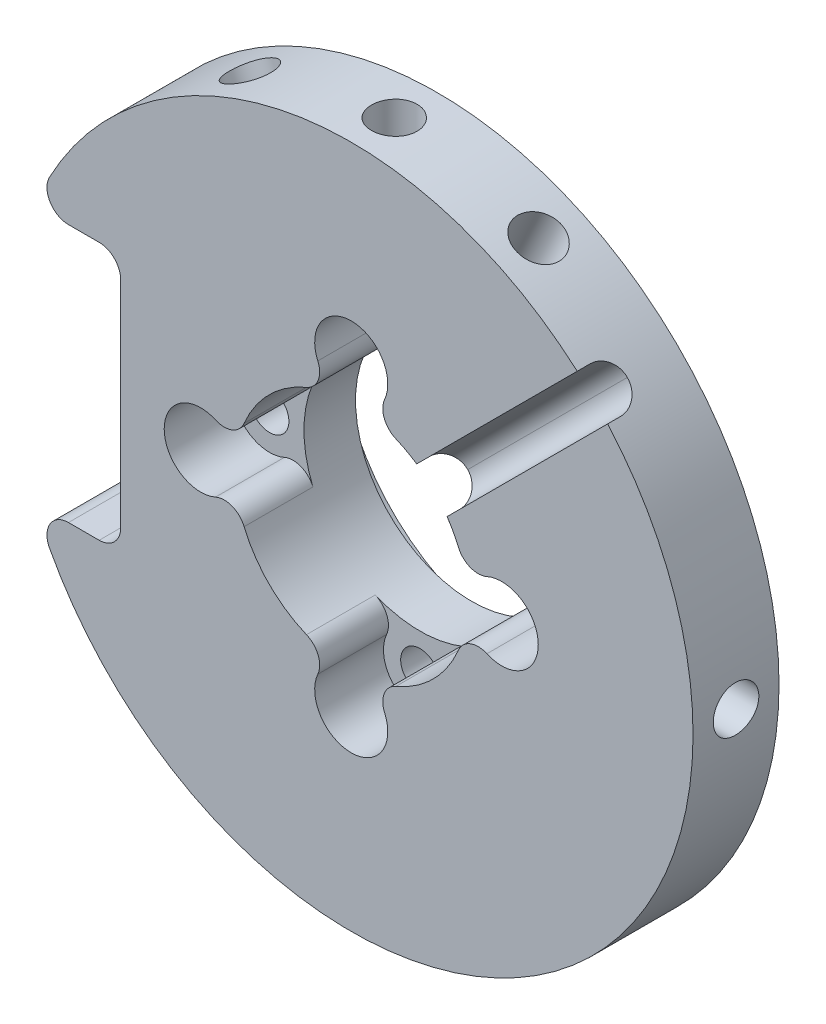
from build123d import *

# Parameters (mm, degrees)
SKETCH_1_R                = 39.75
EXTRUDE_1_DEPTH           = 10
SKETCH_7_R                = 2.65
CUT_EXTRUDE_5_DEPTH       = 8
PATTERN_CIRCULAR_1_COUNT  = 2
PATTERN_CIRCULAR_1_ANGLE  = 25
F_1_THE_OTHER_WAY_COUNT   = 2
F_1_THE_OTHER_WAY_ANGLE   = 25
MIRROR_1_COPY_1_SKETCH_R  = 2.65
MIRROR_1_COPY_1_DEPTH     = 8
MIRROR_1_COPY_2_SKETCH_R  = 2.65
MIRROR_1_COPY_2_DEPTH     = 8
SKETCH_9_R                = 2.65
CUT_EXTRUDE_7_DEPTH       = 8
PATTERN_CIRCULAR_2_COUNT  = 2
CUT_EXTRUDE_START         = -10
CUT_EXTRUDE_8_DEPTH       = 10
CUT_EXTRUDE_13_DEPTH      = 4
SKETCH_12_R               = 25
EXTRUDE_2_DEPTH           = 10
SKETCH_16_R               = 21.4
CUT_EXTRUDE_14_DEPTH      = 6
CUT_EXTRUDE_10_DEPTH      = 58.09750448
CUT_EXTRUDE_10_DEPTH_BACK = 58.09750448
SKETCH_13_R               = 2.25
SKETCH_13_R_2             = 13.5
SKETCH_17_R               = 4.25
CUT_EXTRUDE_15_DEPTH      = 8
FILLET_1_R                = 2.5


# Read off the part's stored shape, not the designer's step: Вырез-Вытянуть8
with BuildPart() as part:
    # Эскиз1 → Бобышка-Вытянуть1 (new body)
    with BuildSketch(Plane.XY):
        Circle(SKETCH_1_R)
    extrude(amount=EXTRUDE_1_DEPTH)

    # Эскиз7 → Вырез-Вытянуть5 (cut)
    with BuildSketch(Plane(origin=(0, 39.75, 0), x_dir=(0, 0, -1), z_dir=(0, 1, 0))):
        with Locations(Location((-5, 0, 0), (0, 0, 90))):
            Circle(SKETCH_7_R)
    cut_extrude_5 = extrude(amount=-CUT_EXTRUDE_5_DEPTH, mode=Mode.SUBTRACT)

    # Круговой массив1: Вырез-Вытянуть5 ×2 about axis
    pattern_circular_1_axis = Axis((0, 0, 10), (0, 0, -1))
    for i in range(1, PATTERN_CIRCULAR_1_COUNT):
        add(cut_extrude_5.rotate(pattern_circular_1_axis, i * PATTERN_CIRCULAR_1_ANGLE / (PATTERN_CIRCULAR_1_COUNT - 1)), mode=Mode.SUBTRACT)

    # 1 the other way: Вырез-Вытянуть5 ×2 about axis
    f_1_the_other_way_axis = Axis((0, 0, 10), (0, 0, 1))
    for i in range(1, F_1_THE_OTHER_WAY_COUNT):
        add(cut_extrude_5.rotate(f_1_the_other_way_axis, i * F_1_THE_OTHER_WAY_ANGLE / (F_1_THE_OTHER_WAY_COUNT - 1)), mode=Mode.SUBTRACT)

    # Зеркальное отражение1: Вырез-Вытянуть5 across plane
    add(cut_extrude_5.mirror(Plane.ZX), mode=Mode.SUBTRACT)

    # Зеркальное отражение1 copy 1 sketch → Зеркальное отражение1 copy 1 (cut)
    with BuildSketch(Plane(origin=(16.799075904, -36.025734535, 0), x_dir=(0, 0, -1), z_dir=(0.4226182617407035, -0.906307787036648, 0))):
        with Locations((-5, 0)):
            Circle(MIRROR_1_COPY_1_SKETCH_R)
    extrude(amount=-MIRROR_1_COPY_1_DEPTH, mode=Mode.SUBTRACT)

    # Зеркальное отражение1 copy 2 sketch → Зеркальное отражение1 copy 2 (cut)
    with BuildSketch(Plane(origin=(-16.799075904, -36.025734535, 0), x_dir=(0, 0, -1), z_dir=(-0.42261826174069717, -0.9063077870366509, 0))):
        with Locations((-5, 0)):
            Circle(MIRROR_1_COPY_2_SKETCH_R)
    extrude(amount=-MIRROR_1_COPY_2_DEPTH, mode=Mode.SUBTRACT)

    # Эскиз9 → Вырез-Вытянуть7 (cut)
    with BuildSketch(Plane.ZY.offset(39.75)):
        with Locations((5, 0)):
            Circle(SKETCH_9_R)
    cut_extrude_7 = extrude(amount=-CUT_EXTRUDE_7_DEPTH, mode=Mode.SUBTRACT)

    # Круговой массив2: Вырез-Вытянуть7 ×2 about axis
    pattern_circular_2_axis = Axis((0, 0, 10), (0, 0, -1))
    for i in range(1, PATTERN_CIRCULAR_2_COUNT):
        add(cut_extrude_7.rotate(pattern_circular_2_axis, i * 360 / PATTERN_CIRCULAR_2_COUNT), mode=Mode.SUBTRACT)

    # Вырез-Вытянуть8 outline → Вырез-Вытянуть8 (cut)
    with BuildSketch(Plane(origin=(0, 0, 0), x_dir=(-1, 0, 0), z_dir=(0, 0, -1)).offset(CUT_EXTRUDE_START)):
        with BuildLine():
            Line((36.811173575, 15), (26.811173575, 15))
            Line((26.811173575, 15), (26.811173575, -15))
            Line((26.811173575, -15), (36.811173575, -15))
            ThreePointArc((36.811173575, -15), (39.75, 0), (36.811173575, 15))
        make_face()
    extrude(amount=CUT_EXTRUDE_8_DEPTH, mode=Mode.SUBTRACT)

    # Эскиз15 → Вырез-Вытянуть13 (cut)
    with BuildSketch(Plane.XY.offset(10)):
        Polygon((-1.767766953, 1.767766953), (1.767766953, -1.767766953), (33.587572106, 30.0520382), (30.0520382, 33.587572106), align=None)
    extrude(amount=-CUT_EXTRUDE_13_DEPTH, mode=Mode.SUBTRACT)

    # Эскиз12 → Бобышка-Вытянуть2 (add)
    with BuildSketch(Plane.XY):
        Circle(SKETCH_12_R)
    extrude(amount=-EXTRUDE_2_DEPTH)

    # Эскиз16 → Вырез-Вытянуть14 (cut)
    with BuildSketch(Plane(origin=(0, 0, -10), x_dir=(-1, 0, 0), z_dir=(0, 0, -1))):
        Circle(SKETCH_16_R)
    extrude(amount=-CUT_EXTRUDE_14_DEPTH, mode=Mode.SUBTRACT)

    # Эскиз13 → Вырез-Вытянуть10 (cut, two sides: drawn at the far end of the back side and taken through both)
    with BuildSketch(Plane.XY.offset(-CUT_EXTRUDE_10_DEPTH_BACK)):
        with Locations((17.5, 0)):
            Circle(SKETCH_13_R)
        with Locations((0, -17.5)):
            Circle(SKETCH_13_R)
        with Locations((-17.5, 0)):
            Circle(SKETCH_13_R)
        with Locations((0, 17.5)):
            Circle(SKETCH_13_R)
        Circle(SKETCH_13_R_2)
    extrude(amount=CUT_EXTRUDE_10_DEPTH + CUT_EXTRUDE_10_DEPTH_BACK, mode=Mode.SUBTRACT)

    # Эскиз17 → Вырез-Вытянуть15 (cut)
    with BuildSketch(Plane.XY.offset(10)):
        with Locations((0, 17.5)):
            Circle(SKETCH_17_R)
        with Locations((17.5, 0)):
            Circle(SKETCH_17_R)
        with Locations((0, -17.5)):
            Circle(SKETCH_17_R)
        with Locations((-17.5, 0)):
            Circle(SKETCH_17_R)
    extrude(amount=-CUT_EXTRUDE_15_DEPTH, mode=Mode.SUBTRACT)

    # Скругление1
    fillet_1_edges = [part.edges().sort_by_distance(p)[0] for p in [
        (20.48410737, 16.948573464, 6),
        (16.948573464, 20.48410737, 6),
        (-26.811173575, 15, 5),
        (-26.811173575, -15, 5),
    ]]
    fillet(fillet_1_edges, radius=FILLET_1_R - 0.0004)  # a hair under: the kernel refuses the full size
    fillet_1_2_edges = [part.edges().sort_by_distance(p)[0] for p in [
        (-36.811173575, -15, 5),
        (-36.811173575, 15, 5),
        (-1.259999544, -13.441071429, 6),
        (1.259999544, -13.441071429, 6),
        (13.441071429, -1.259999544, 6),
        (13.441071429, 1.259999544, 6),
        (-13.441071429, 1.259999544, 6),
        (-13.441071429, -1.259999544, 6),
        (-1.259999544, 13.441071429, 6),
        (1.259999544, 13.441071429, 6),
    ]]
    fillet(fillet_1_2_edges, radius=FILLET_1_R)


solid = part.part
